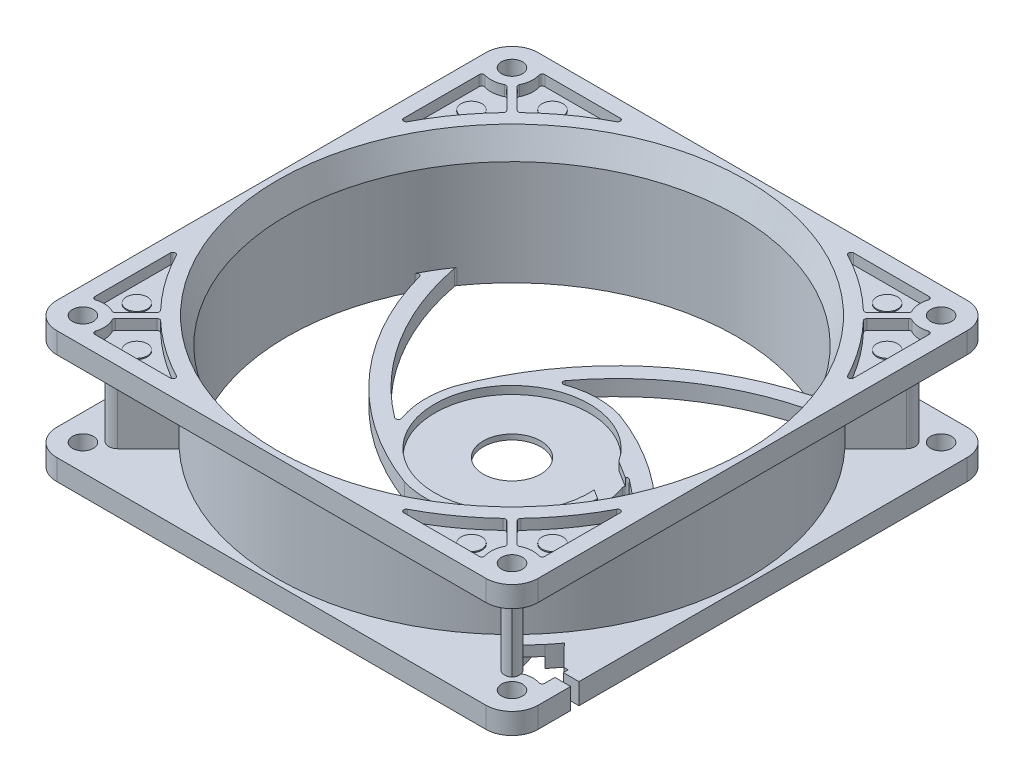
from build123d import *

# Parameters (mm, degrees)
SKETCH1_W                = 92
SKETCH1_H                = 92
BOSS_EXTRUDE1_DEPTH      = 25
SKETCH2_W                = 22.579170648
SKETCH2_H                = 17
SKETCH3_R                = 43
CUT_EXTRUDE1_DEPTH       = 70.692180336
CHAMFER1_SIZE            = 1.8
CHAMFER1_SIZE2           = 4.945459355
SKETCH4_R                = 2
CUT_EXTRUDE2_DEPTH       = 70.692180336
MIRROR2_COPY_1_SKETCH_R  = 2
MIRROR2_COPY_1_DEPTH     = 70.692180336
FILLET1_R                = 5
BOSS_EXTRUDE2_REACH      = 124.612
BOSS_EXTRUDE2_END_RADIUS = 45
SKETCH6_W                = 3
SKETCH6_H                = 17.774430808
FILLET2_R                = 1.7
CIRPATTERN1_COUNT        = 4
FILLET2_OF_CIRPATTERN1_R = 1.7
BOSS_EXTRUDE3_DEPTH      = 3
FILLET3_R                = 0.5
CUT_EXTRUDE3_DEPTH       = 2
CIRPATTERN2_COUNT        = 4
SKETCH12_R               = 2
BOSS_EXTRUDE4_DEPTH      = 0.2
CIRPATTERN3_COUNT        = 4
MIRROR3_COPY_1_DEPTH     = 2
MIRROR3_COPY_2_DEPTH     = 2
MIRROR3_COPY_3_DEPTH     = 2
SKETCH14_R               = 15
CUT_EXTRUDE4_DEPTH       = 0.5
SKETCH15_R               = 5.5
CUT_EXTRUDE5_DEPTH       = 70.514387132
BOSS_EXTRUDE9_DEPTH      = 1
SKETCH29_R               = 14.75
CUT_EXTRUDE10_DEPTH      = 1.5
BOSS_EXTRUDE10_DEPTH     = 2
CUT_EXTRUDE11_DEPTH      = 1.5
CUT_EXTRUDE6_DEPTH       = 2
CUT_EXTRUDE7_DEPTH       = 5
CUT_EXTRUDE7_DEPTH_BACK  = 2
BOSS_EXTRUDE12_DEPTH     = 0.5
CUT_EXTRUDE9_DEPTH       = 2
CUT_EXTRUDE8_DEPTH       = 0.1


with BuildPart() as part:
    # Sketch1 → Boss-Extrude1 (new body)
    with BuildSketch(Plane(origin=(0, 0, 0), x_dir=(1, 0, 0), z_dir=(0, 1, 0))):
        Rectangle(SKETCH1_W, SKETCH1_H)
    extrude(amount=BOSS_EXTRUDE1_DEPTH)

    # Sketch2 → Cut-Revolve1 (revolve, cut)
    with BuildSketch(Plane.XY, mode=Mode.PRIVATE) as cut_revolve1_sk:
        with Locations((56.289585324, 12.5)):
            Rectangle(SKETCH2_W, SKETCH2_H)
    revolve(cut_revolve1_sk.sketch.rotate(Axis((0, 29.698257865, 0), (0, -1, 0)), 90), axis=Axis((0, 29.698257865, 0), (0, -1, 0)), mode=Mode.SUBTRACT)

    # Sketch3 → Cut-Extrude1 (cut, through all)
    with BuildSketch(Plane(origin=(0, 25, 0), x_dir=(1, 0, 0), z_dir=(0, 1, 0))):
        with Locations(Location((0, 0, 0), (0, 0, 270))):
            Circle(SKETCH3_R)
    extrude(amount=-CUT_EXTRUDE1_DEPTH, mode=Mode.SUBTRACT)

    # Chamfer1
    chamfer1_edges = [part.edges().sort_by_distance(p)[0] for p in [
        (0, 25, -43),
    ]]
    chamfer1_side = [part.faces().sort_by_distance(p)[0] for p in [
        (0, 25, -44.698923523),
    ]]
    chamfer(chamfer1_edges, length=CHAMFER1_SIZE, length2=CHAMFER1_SIZE2, reference=chamfer1_side[0])

    # Sketch4 → Cut-Extrude2 (cut, through all)
    with BuildSketch(Plane(origin=(0, 25, 0), x_dir=(1, 0, 0), z_dir=(0, 1, 0))):
        with Locations(Location((41, 41, 0), (0, 0, 270))):
            Circle(SKETCH4_R)
    cut_extrude2 = extrude(amount=-CUT_EXTRUDE2_DEPTH, mode=Mode.SUBTRACT)

    # Mirror1: Cut-Extrude2 across plane
    add(cut_extrude2.mirror(Plane(origin=(0, 0, 0), x_dir=(0, 0, 1), z_dir=(1, 0, 0))), mode=Mode.SUBTRACT)

    # Mirror2: Cut-Extrude2 across plane
    add(cut_extrude2.mirror(Plane.XY), mode=Mode.SUBTRACT)

    # Mirror2 copy 1 sketch → Mirror2 copy 1 (cut, through all)
    with BuildSketch(Plane(origin=(0, 25, 0), x_dir=(-1, 0, 0), z_dir=(0, 1, 0))):
        with Locations(Location((41, 41, 0), (0, 0, 270))):
            Circle(MIRROR2_COPY_1_SKETCH_R)
    extrude(amount=-MIRROR2_COPY_1_DEPTH, mode=Mode.SUBTRACT)

    # Fillet1
    fillet1_edges = [part.edges().sort_by_distance(p)[0] for p in [
        (-46, 2, -46),
        (46, 2, -46),
        (46, 2, 46),
        (-46, 2, 46),
        (-46, 23, -46),
        (46, 23, -46),
        (46, 23, 46),
        (-46, 23, 46),
    ]]
    fillet(fillet1_edges, radius=FILLET1_R)

    # Boss-Extrude2: up to this cylinder (the profile starts outside it)
    boss_extrude2_end = Plane(origin=(0, 12.443221, 0), z_dir=(0, 1, 0)) * Cylinder(BOSS_EXTRUDE2_END_RADIUS, 340.224, mode=Mode.PRIVATE)
    # Sketch6 → Boss-Extrude2 (add, up to the surface)
    with BuildSketch(Plane(origin=(-38.878679656, 0, 38.878679656), x_dir=(-0.7071067811865487, 0, -0.7071067811865465), z_dir=(0.7071067811865465, 0, -0.7071067811865487)), mode=Mode.PRIVATE) as boss_extrude2_sk1:
        with Locations((0, 12.443220883)):
            Rectangle(SKETCH6_W, SKETCH6_H)
    boss_extrude2_tool1 = extrude(boss_extrude2_sk1.sketch, amount=BOSS_EXTRUDE2_REACH, mode=Mode.PRIVATE) - boss_extrude2_end
    boss_extrude2 = boss_extrude2_tool1.solids().sort_by_distance((-38.87868, 12.443221, 38.87868))[0]
    add(boss_extrude2)

    # Fillet2
    # the kernel refuses this fillet: 1.7 mm, written as the material it takes off along each edge
    with BuildSketch(Plane(origin=(-37.818019485, 21, 39.939339828), x_dir=(0.7071067811865475, 0, -0.7071067811865475), z_dir=(0, -1, 0))) as fillet2_piece_1:
        with BuildLine():
            CenterArc((FILLET2_R, -FILLET2_R), FILLET2_R, 90, 90)
            Line((0, -FILLET2_R), (0, 0))
            Line((0, 0), (FILLET2_R, 0))
        make_face()
    extrude(amount=17, mode=Mode.SUBTRACT)
    with BuildSketch(Plane(origin=(-39.939339828, 4, 37.818019485), x_dir=(0.7071067811865475, 0, 0.7071067811865475), z_dir=(0, 1, 0))) as fillet2_piece_2:
        with BuildLine():
            CenterArc((FILLET2_R, FILLET2_R), FILLET2_R, 180, 90)
            Line((0, FILLET2_R), (0, 0))
            Line((0, 0), (FILLET2_R, 0))
        make_face()
    extrude(amount=17, mode=Mode.SUBTRACT)

    # CirPattern1: Boss-Extrude2 ×4 about axis
    cirpattern1_axis = Axis((0, 0, 0), (0, 1, 0))
    for i in range(1, CIRPATTERN1_COUNT):
        add(boss_extrude2.rotate(cirpattern1_axis, i * 360 / CIRPATTERN1_COUNT))

    # Fillet2 of CirPattern1
    # the kernel refuses this fillet: 1.7 mm, written as the material it takes off along each edge
    with BuildSketch(Plane(origin=(39.939339828, 21, 37.818019485), x_dir=(-0.7071067811865475, 0, -0.7071067811865475), z_dir=(0, -1, 0)), Plane(origin=(37.818019485, 21, -39.939339828), x_dir=(-0.7071067811865455, 0, 0.7071067811865496), z_dir=(0, -1, 0)), Plane(origin=(-39.939339828, 21, -37.818019485), x_dir=(0.7071067811865475, 0, 0.7071067811865475), z_dir=(0, -1, 0))) as fillet2_of_cirpattern1_piece_1:
        with BuildLine():
            CenterArc((FILLET2_OF_CIRPATTERN1_R, -FILLET2_OF_CIRPATTERN1_R), FILLET2_OF_CIRPATTERN1_R, 90, 90)
            Line((0, -FILLET2_OF_CIRPATTERN1_R), (0, 0))
            Line((0, 0), (FILLET2_OF_CIRPATTERN1_R, 0))
        make_face()
    extrude(amount=17, mode=Mode.SUBTRACT)
    with BuildSketch(Plane(origin=(37.818019485, 4, 39.939339828), x_dir=(0.7071067811865475, 0, -0.7071067811865475), z_dir=(0, 1, 0)), Plane(origin=(39.939339828, 4, -37.818019485), x_dir=(-0.7071067811865475, 0, -0.7071067811865475), z_dir=(0, 1, 0)), Plane(origin=(-37.818019485, 4, -39.939339828), x_dir=(-0.7071067811865475, 0, 0.7071067811865475), z_dir=(0, 1, 0))) as fillet2_of_cirpattern1_piece_2:
        with BuildLine():
            CenterArc((FILLET2_OF_CIRPATTERN1_R, FILLET2_OF_CIRPATTERN1_R), FILLET2_OF_CIRPATTERN1_R, 180, 90)
            Line((0, FILLET2_OF_CIRPATTERN1_R), (0, 0))
            Line((0, 0), (FILLET2_OF_CIRPATTERN1_R, 0))
        make_face()
    extrude(amount=17, mode=Mode.SUBTRACT)

    # Sketch7 → Boss-Extrude3 (add)
    with BuildSketch(Plane.XZ):
        with BuildLine():
            ThreePointArc((7.158364542, 14.866331662), (1.306825925, 16.448167254), (-4.721081188, 15.810167375))
            ThreePointArc((-4.721081188, 15.810167375), (-26.212481755, 0.982498129), (-37.963959424, -22.333651771))
            ThreePointArc((-37.963959424, -22.333651771), (-36.823205131, -24.168280462), (-35.59386536, -25.944767591))
            ThreePointArc((-35.59386536, -25.944767591), (-28.613156446, -7.274899031), (-14.866331662, 7.158364542))
            ThreePointArc((-14.866331662, 7.158364542), (-16.448167254, 1.306825925), (-15.810167375, -4.721081188))
            ThreePointArc((-15.810167375, -4.721081188), (-0.982498129, -26.212481755), (22.333651771, -37.963959424))
            ThreePointArc((22.333651771, -37.963959424), (24.168280462, -36.823205131), (25.944767591, -35.59386536))
            ThreePointArc((25.944767591, -35.59386536), (7.274899031, -28.613156446), (-7.158364542, -14.866331662))
            ThreePointArc((-7.158364542, -14.866331662), (-1.306825925, -16.448167254), (4.721081188, -15.810167375))
            ThreePointArc((4.721081188, -15.810167375), (26.212481755, -0.982498129), (37.963959424, 22.333651771))
            ThreePointArc((37.963959424, 22.333651771), (36.823205131, 24.168280462), (35.59386536, 25.944767591))
            ThreePointArc((35.59386536, 25.944767591), (28.613156446, 7.274899031), (14.866331662, -7.158364542))
            ThreePointArc((14.866331662, -7.158364542), (16.448167254, -1.306825925), (15.810167375, 4.721081188))
            ThreePointArc((15.810167375, 4.721081188), (0.982498129, 26.212481755), (-22.333651771, 37.963959424))
            ThreePointArc((-22.333651771, 37.963959424), (-24.168280462, 36.823205131), (-25.944767591, 35.59386536))
            ThreePointArc((-25.944767591, 35.59386536), (-7.274899031, 28.613156446), (7.158364542, 14.866331662))
        make_face()
    extrude(amount=-BOSS_EXTRUDE3_DEPTH)

    # Fillet3
    fillet3_edges = [part.edges().sort_by_distance(p)[0] for p in [
        (20.840463244, 1.5, -37.612166805),
        (24.492242347, 1.5, -35.343034177),
        (37.612166805, 1.5, 20.840463244),
        (35.343034177, 1.5, 24.492242347),
        (-20.840463244, 1.5, 37.612166805),
        (-24.492242347, 1.5, 35.343034177),
        (-37.612166805, 1.5, -20.840463244),
        (-35.343034177, 1.5, -24.492242347),
        (14.866331662, 1.5, -7.158364542),
        (-7.158364542, 1.5, -14.866331662),
        (-14.866331662, 1.5, 7.158364542),
        (7.158364542, 1.5, 14.866331662),
    ]]
    fillet(fillet3_edges, radius=FILLET3_R)

    # Sketch8 → Cut-Extrude3 (cut)
    with BuildSketch(Plane(origin=(0, 25, 0), x_dir=(1, 0, 0), z_dir=(0, 1, 0))):
        with BuildLine():
            Line((43, 36.730303993), (43, 22.310311517))
            ThreePointArc((43, 22.310311517), (42.619678388, 21.824845676), (42.057291667, 22.077912439))
            ThreePointArc((42.057291667, 22.077912439), (38.609343919, 27.668909666), (34.423047016, 32.730778086))
            ThreePointArc((34.423047016, 32.730778086), (34.285417761, 33.080096025), (34.429705273, 33.426716781))
            Line((34.429705273, 33.426716781), (38.359196897, 37.404129034))
            ThreePointArc((38.359196897, 37.404129034), (38.636013896, 37.546464768), (38.943397852, 37.49745236))
            ThreePointArc((38.943397852, 37.49745236), (40.618067312, 37.016237359), (42.35, 37.207273594))
            ThreePointArc((42.35, 37.207273594), (42.795803989, 37.13341688), (43, 36.730303993))
        make_face()
        with BuildLine():
            Line((37.404129034, 38.359196897), (33.426716781, 34.429705273))
            ThreePointArc((33.426716781, 34.429705273), (33.080096025, 34.285417761), (32.730778086, 34.423047016))
            ThreePointArc((32.730778086, 34.423047016), (27.668909666, 38.609343919), (22.077912439, 42.057291667))
            ThreePointArc((22.077912439, 42.057291667), (21.824845676, 42.619678388), (22.310311517, 43))
            Line((22.310311517, 43), (36.730303993, 43))
            ThreePointArc((36.730303993, 43), (37.13341688, 42.795803989), (37.207273594, 42.35))
            ThreePointArc((37.207273594, 42.35), (37.016237359, 40.618067312), (37.49745236, 38.943397852))
            ThreePointArc((37.49745236, 38.943397852), (37.546464768, 38.636013896), (37.404129034, 38.359196897))
        make_face()
    cut_extrude3 = extrude(amount=-CUT_EXTRUDE3_DEPTH, mode=Mode.SUBTRACT)

    # CirPattern2: Cut-Extrude3 ×4 about axis
    cirpattern2_axis = Axis((0, 0, 0), (0, 1, 0))
    for i in range(1, CIRPATTERN2_COUNT):
        add(cut_extrude3.rotate(cirpattern2_axis, i * 360 / CIRPATTERN2_COUNT), mode=Mode.SUBTRACT)

    # Sketch12 → Boss-Extrude4 (add)
    with BuildSketch(Plane(origin=(0, 23, 0), x_dir=(1, 0, 0), z_dir=(0, 1, 0))):
        with Locations(Location((31.980380513, 39.727260945, 0), (0, 0, 90))):
            Circle(SKETCH12_R)
        with Locations(Location((39.727260945, 31.980380513, 0), (0, 0, 270))):
            Circle(SKETCH12_R)
    boss_extrude4 = extrude(amount=BOSS_EXTRUDE4_DEPTH)

    # CirPattern3: Boss-Extrude4 ×4 about axis
    cirpattern3_axis = Axis((0, 0, 0), (0, 1, 0))
    for i in range(1, CIRPATTERN3_COUNT):
        add(boss_extrude4.rotate(cirpattern3_axis, i * 360 / CIRPATTERN3_COUNT))

    # Mirror3: Cut-Extrude3 across plane
    add(cut_extrude3.mirror(Plane.ZX.offset(12.5)), mode=Mode.SUBTRACT)

    # Mirror3 copy 1 sketch → Mirror3 copy 1 (cut)
    with BuildSketch(Plane(origin=(0, 0, 0), x_dir=(0, 0, -1), z_dir=(0, -1, 0))):
        with BuildLine():
            Line((43, -36.730303993), (43, -22.310311517))
            ThreePointArc((43, -22.310311517), (42.619678388, -21.824845676), (42.057291667, -22.077912439))
            ThreePointArc((42.057291667, -22.077912439), (38.609343919, -27.668909666), (34.423047016, -32.730778086))
            ThreePointArc((34.423047016, -32.730778086), (34.285417761, -33.080096025), (34.429705273, -33.426716781))
            Line((34.429705273, -33.426716781), (38.359196897, -37.404129034))
            ThreePointArc((38.359196897, -37.404129034), (38.636013896, -37.546464768), (38.943397852, -37.49745236))
            ThreePointArc((38.943397852, -37.49745236), (40.618067312, -37.016237359), (42.35, -37.207273594))
            ThreePointArc((42.35, -37.207273594), (42.795803989, -37.13341688), (43, -36.730303993))
        make_face()
        with BuildLine():
            Line((37.404129034, -38.359196897), (33.426716781, -34.429705273))
            ThreePointArc((33.426716781, -34.429705273), (33.080096025, -34.285417761), (32.730778086, -34.423047016))
            ThreePointArc((32.730778086, -34.423047016), (27.668909666, -38.609343919), (22.077912439, -42.057291667))
            ThreePointArc((22.077912439, -42.057291667), (21.824845676, -42.619678388), (22.310311517, -43))
            Line((22.310311517, -43), (36.730303993, -43))
            ThreePointArc((36.730303993, -43), (37.13341688, -42.795803989), (37.207273594, -42.35))
            ThreePointArc((37.207273594, -42.35), (37.016237359, -40.618067312), (37.49745236, -38.943397852))
            ThreePointArc((37.49745236, -38.943397852), (37.546464768, -38.636013896), (37.404129034, -38.359196897))
        make_face()
    extrude(amount=-MIRROR3_COPY_1_DEPTH, mode=Mode.SUBTRACT)

    # Mirror3 copy 2 sketch → Mirror3 copy 2 (cut)
    with BuildSketch(Plane(origin=(0, 0, 0), x_dir=(-1, 0, 0), z_dir=(0, -1, 0))):
        with BuildLine():
            Line((43, -36.730303993), (43, -22.310311517))
            ThreePointArc((43, -22.310311517), (42.619678388, -21.824845676), (42.057291667, -22.077912439))
            ThreePointArc((42.057291667, -22.077912439), (38.609343919, -27.668909666), (34.423047016, -32.730778086))
            ThreePointArc((34.423047016, -32.730778086), (34.285417761, -33.080096025), (34.429705273, -33.426716781))
            Line((34.429705273, -33.426716781), (38.359196897, -37.404129034))
            ThreePointArc((38.359196897, -37.404129034), (38.636013896, -37.546464768), (38.943397852, -37.49745236))
            ThreePointArc((38.943397852, -37.49745236), (40.618067312, -37.016237359), (42.35, -37.207273594))
            ThreePointArc((42.35, -37.207273594), (42.795803989, -37.13341688), (43, -36.730303993))
        make_face()
        with BuildLine():
            Line((37.404129034, -38.359196897), (33.426716781, -34.429705273))
            ThreePointArc((33.426716781, -34.429705273), (33.080096025, -34.285417761), (32.730778086, -34.423047016))
            ThreePointArc((32.730778086, -34.423047016), (27.668909666, -38.609343919), (22.077912439, -42.057291667))
            ThreePointArc((22.077912439, -42.057291667), (21.824845676, -42.619678388), (22.310311517, -43))
            Line((22.310311517, -43), (36.730303993, -43))
            ThreePointArc((36.730303993, -43), (37.13341688, -42.795803989), (37.207273594, -42.35))
            ThreePointArc((37.207273594, -42.35), (37.016237359, -40.618067312), (37.49745236, -38.943397852))
            ThreePointArc((37.49745236, -38.943397852), (37.546464768, -38.636013896), (37.404129034, -38.359196897))
        make_face()
    extrude(amount=-MIRROR3_COPY_2_DEPTH, mode=Mode.SUBTRACT)

    # Mirror3 copy 3 sketch → Mirror3 copy 3 (cut)
    with BuildSketch(Plane(origin=(0, 0, 0), x_dir=(0, 0, 1), z_dir=(0, -1, 0))):
        with BuildLine():
            Line((43, -36.730303993), (43, -22.310311517))
            ThreePointArc((43, -22.310311517), (42.619678388, -21.824845676), (42.057291667, -22.077912439))
            ThreePointArc((42.057291667, -22.077912439), (38.609343919, -27.668909666), (34.423047016, -32.730778086))
            ThreePointArc((34.423047016, -32.730778086), (34.285417761, -33.080096025), (34.429705273, -33.426716781))
            Line((34.429705273, -33.426716781), (38.359196897, -37.404129034))
            ThreePointArc((38.359196897, -37.404129034), (38.636013896, -37.546464768), (38.943397852, -37.49745236))
            ThreePointArc((38.943397852, -37.49745236), (40.618067312, -37.016237359), (42.35, -37.207273594))
            ThreePointArc((42.35, -37.207273594), (42.795803989, -37.13341688), (43, -36.730303993))
        make_face()
        with BuildLine():
            Line((37.404129034, -38.359196897), (33.426716781, -34.429705273))
            ThreePointArc((33.426716781, -34.429705273), (33.080096025, -34.285417761), (32.730778086, -34.423047016))
            ThreePointArc((32.730778086, -34.423047016), (27.668909666, -38.609343919), (22.077912439, -42.057291667))
            ThreePointArc((22.077912439, -42.057291667), (21.824845676, -42.619678388), (22.310311517, -43))
            Line((22.310311517, -43), (36.730303993, -43))
            ThreePointArc((36.730303993, -43), (37.13341688, -42.795803989), (37.207273594, -42.35))
            ThreePointArc((37.207273594, -42.35), (37.016237359, -40.618067312), (37.49745236, -38.943397852))
            ThreePointArc((37.49745236, -38.943397852), (37.546464768, -38.636013896), (37.404129034, -38.359196897))
        make_face()
    extrude(amount=-MIRROR3_COPY_3_DEPTH, mode=Mode.SUBTRACT)

    # Sketch14 → Cut-Extrude4 (cut)
    with BuildSketch(Plane.XZ):
        with Locations(Location((0, 0, 0), (0, 0, 270))):
            Circle(SKETCH14_R)
    extrude(amount=-CUT_EXTRUDE4_DEPTH, mode=Mode.SUBTRACT)

    # Sketch15 → Cut-Extrude5 (cut, through all)
    with BuildSketch(Plane.XZ.offset(-0.5)):
        with Locations(Location((0, 0, 0), (0, 0, 270))):
            Circle(SKETCH15_R)
    extrude(amount=-CUT_EXTRUDE5_DEPTH, mode=Mode.SUBTRACT)

    # Sketch17 → Boss-Extrude9 (add)
    with BuildSketch(Plane(origin=(0, 3, 0), x_dir=(1, 0, 0), z_dir=(0, 1, 0))):
        with BuildLine():
            Line((31.968986992, -29.039528818), (35.490310689, -24.662662473))
            add(Edge.make_bspline(
                [(35.490310689, -24.662662473), (34.227748362, -18.671049214), (31.737570542, -13.088906043)],
                knots=[0, 0, 0, 1, 1, 1], degree=2))
            add(Edge.make_bspline(
                [(29.528388111, -18.279113138), (29.908646123, -17.825834704), (30.6691615, -16.756558488), (31.434541265, -15.034454016), (31.684978269, -13.728619809), (31.737570542, -13.088906043)],
                knots=[-0.308656209, -0.308656209, -0.308656209, -0.308656209, 0, 0.398701918, 0.760704377, 0.760704377, 0.760704377, 0.760704377], degree=3))
            add(Edge.make_bspline(
                [(31.968986992, -29.039528818), (31.66307007, -25.375812994), (30.833551418, -21.738363156), (29.528388111, -18.279113138)],
                knots=[-0.165028379, -0.165028379, -0.165028379, -0.165028379, 0.208320797, 0.208320797, 0.208320797, 0.208320797], degree=3))
        make_face()
        with BuildLine():
            add(Edge.make_bspline(
                [(25.291083942, -2.598412547), (25.712592204, -3.409899451), (26.292599735, -5.357542042), (25.829105286, -7.51858215), (25.097106742, -8.862058339), (24.993684366, -9.038117799)],
                knots=[0.002563703, 0.002563703, 0.002563703, 0.002563703, 0.421761804, 1, 1.087031359, 1.087031359, 1.087031359, 1.087031359], degree=3))
            add(Edge.make_bspline(
                [(26.287693076, -11.188647931), (25.955351111, -10.600231442), (25.527744108, -9.880937932), (25.080292569, -9.173466482), (24.993684366, -9.038117799)],
                knots=[0.439894749, 0.439894749, 0.439894749, 0.439894749, 0.5, 0.514276963, 0.514276963, 0.514276963, 0.514276963], degree=3))
            add(Edge.make_bspline(
                [(26.287693076, -11.188647931), (26.436894902, -10.981056518), (27.052592206, -10.044773676), (27.740325185, -8.323089796), (27.812397607, -6.719279515), (27.719113272, -5.902081132)],
                knots=[-0.128523717, -0.128523717, -0.128523717, -0.128523717, 0, 0.445158587, 0.8798955, 0.8798955, 0.8798955, 0.8798955], degree=3))
            add(Edge.make_bspline(
                [(27.719113272, -5.902081132), (26.825878823, -4.02366417), (25.291083942, -2.598412547)],
                knots=[0, 0, 0, 1, 1, 1], degree=2))
        make_face()
    extrude(amount=-BOSS_EXTRUDE9_DEPTH)

    # Sketch29 → Cut-Extrude10 (cut)
    with BuildSketch(Plane(origin=(0, 3, 0), x_dir=(1, 0, 0), z_dir=(0, 1, 0))):
        with Locations(Location((0, 0, 0), (0, 0, 270))):
            Circle(SKETCH29_R)
    extrude(amount=-CUT_EXTRUDE10_DEPTH, mode=Mode.SUBTRACT)

    # Sketch19 → Boss-Extrude10 (add)
    with BuildSketch(Plane.XZ.offset(-2)):
        with BuildLine():
            Line((31.946632125, 28.782159333), (32.859703269, 27.869143076))
            add(Edge.make_bspline(
                [(32.859703269, 27.869143076), (32.188125298, 22.449716722), (30.245371821, 17.3233502)],
                knots=[0, 0, 0, 1, 1, 1], degree=2))
            add(Edge.make_bspline(
                [(30.245371821, 17.3233502), (30.029351866, 17.648250725), (29.790357296, 17.966838371), (29.528388111, 18.279113138)],
                knots=[0.548063451, 0.548063451, 0.548063451, 0.548063451, 0.760704377, 0.760704377, 0.760704377, 0.760704377], degree=3))
            add(Edge.make_bspline(
                [(29.528388111, 18.279113138), (30.802984257, 21.657346896), (31.623954224, 25.205531274), (31.946632125, 28.782159333)],
                knots=[-0.165028379, -0.165028379, -0.165028379, -0.165028379, 0.199576892, 0.199576892, 0.199576892, 0.199576892], degree=3))
        make_face()
        with BuildLine():
            ThreePointArc((24.993684366, 9.038117799), (25.655502814, 10.104468986), (26.287693076, 11.188647931))
            add(Edge.make_bspline(
                [(26.287693076, 11.188647931), (26.436894902, 10.981056518), (26.646453792, 10.662383053), (26.830011127, 10.338708497), (26.889709538, 10.22749976)],
                knots=[-0.128523717, -0.128523717, -0.128523717, -0.128523717, 0, 0.066734937, 0.066734937, 0.066734937, 0.066734937], degree=3))
            ThreePointArc((26.889709538, 10.22749976), (26.217768579, 9.105995425), (25.514598713, 8.003802716))
            add(Edge.make_bspline(
                [(25.514598713, 8.003802716), (25.443855196, 8.172535913), (25.285271383, 8.51670968), (25.097106742, 8.862058339), (24.993684366, 9.038117799)],
                knots=[0.916019807, 0.916019807, 0.916019807, 0.916019807, 1, 1.087031359, 1.087031359, 1.087031359, 1.087031359], degree=3))
        make_face()
    extrude(amount=BOSS_EXTRUDE10_DEPTH)

    # Sketch30 → Cut-Extrude11 (cut)
    with BuildSketch(Plane(origin=(0, 3, 0), x_dir=(1, 0, 0), z_dir=(0, 1, 0))):
        Polygon((16.464844324, 5.507497551), (9.111538701, 10.073933919), (12.263454178, 2.508651495), (17.134361713, -0.516204326), align=None)
    extrude(amount=-CUT_EXTRUDE11_DEPTH, mode=Mode.SUBTRACT)

    # Sketch20 → Cut-Extrude6 (cut)
    with BuildSketch(Plane.XZ):
        with BuildLine():
            Line((35.233202521, 23.926052173), (36.691454633, 30.880001475))
            ThreePointArc((36.691454633, 30.880001475), (35.627651477, 32.101523087), (34.523202161, 33.286421358))
            Line((34.523202161, 33.286421358), (32.845093976, 27.752473795))
            Line((32.845093976, 27.752473795), (35.233202521, 23.926052173))
        make_face()
    extrude(amount=-CUT_EXTRUDE6_DEPTH, mode=Mode.SUBTRACT)

    # Sketch22 → Cut-Extrude7 (cut, two sides: drawn at the far end of the back side and taken through both)
    with BuildSketch(Plane.XZ.offset(-2).offset(-CUT_EXTRUDE7_DEPTH_BACK)):
        with BuildLine():
            Line((43, 34.8), (48.362209946, 34.8))
            Line((48.362209946, 34.8), (48.362209946, 33.2))
            Line((48.362209946, 33.2), (43, 33.2))
            Line((43, 33.2), (43, 32.281827486))
            Line((43, 32.281827486), (41.878589985, 32.281827486))
            ThreePointArc((41.878589985, 32.281827486), (41.107627442, 32.127258806), (40.455831561, 31.687444242))
            Line((40.455831561, 31.687444242), (38.40835597, 29.614999437))
            ThreePointArc((38.40835597, 29.614999437), (36.984458279, 31.375146945), (35.479970649, 33.066927325))
            Line((35.479970649, 33.066927325), (38.375847615, 35.998119864))
            ThreePointArc((38.375847615, 35.998119864), (39.027643496, 36.437934427), (39.79860604, 36.592503107))
            Line((39.79860604, 36.592503107), (43, 36.592503107))
            Line((43, 36.592503107), (43, 34.8))
        make_face()
    extrude(amount=CUT_EXTRUDE7_DEPTH + CUT_EXTRUDE7_DEPTH_BACK, mode=Mode.SUBTRACT)

    # Sketch23 → Boss-Extrude12 (add)
    with BuildSketch(Plane.XZ):
        with BuildLine():
            ThreePointArc((31.165650768, 19.995901821), (33.225613786, 21.206005861), (32.052807237, 23.287429466))
            add(Edge.make_bspline(
                [(31.165650768, 19.995901821), (31.671731671, 21.627256129), (32.052807237, 23.287429466)],
                knots=[0, 0, 0, 1, 1, 1], degree=2))
        make_face()
    extrude(amount=-BOSS_EXTRUDE12_DEPTH)

    # Sketch28 → Cut-Extrude9 (cut)
    with BuildSketch(Plane.XZ.offset(-2)):
        with BuildLine():
            Line((34.373314982, 32.792133924), (36.572057745, 30.31063497))
            ThreePointArc((36.572057745, 30.31063497), (37.405518227, 29.275880963), (38.209711269, 28.218220439))
            Line((38.209711269, 28.218220439), (43, 33.066927325))
            Line((43, 33.066927325), (43, 36.730303993))
            ThreePointArc((43, 36.730303993), (42.795803989, 37.13341688), (42.35, 37.207273594))
            ThreePointArc((42.35, 37.207273594), (40.618067312, 37.016237359), (38.943397852, 37.49745236))
            ThreePointArc((38.943397852, 37.49745236), (38.636013896, 37.546464768), (38.359196897, 37.404129034))
            Line((38.359196897, 37.404129034), (34.429705273, 33.426716781))
            ThreePointArc((34.429705273, 33.426716781), (34.287357378, 33.119569193), (34.373314982, 32.792133924))
        make_face()
    extrude(amount=-CUT_EXTRUDE9_DEPTH, mode=Mode.SUBTRACT)

    # Sketch27 → Cut-Extrude8 (cut)
    with BuildSketch(Plane.XZ.offset(-2)):
        Polygon((26.241719614, 6.770910377), (25.821998659, 8.154081705), (25.888772448, 8.154081705), (26.382560804, 6.813648393), align=None)
    extrude(amount=-CUT_EXTRUDE8_DEPTH, mode=Mode.SUBTRACT)


solid = part.part
